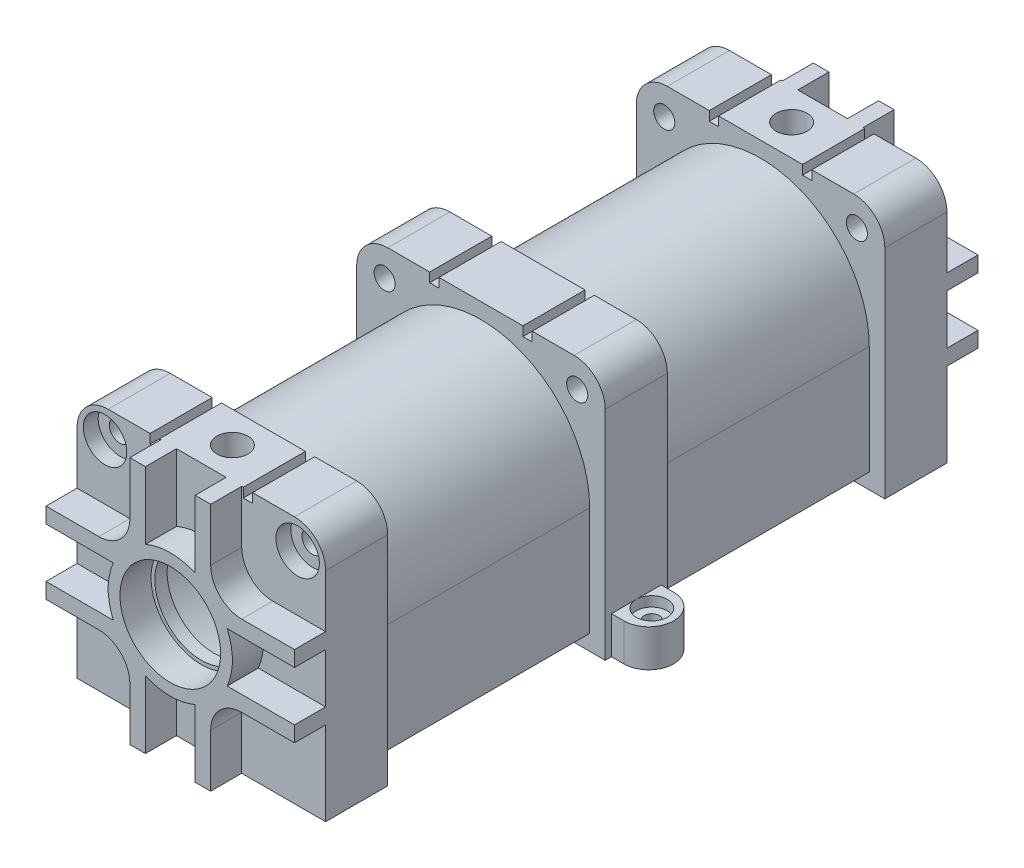
from build123d import *

# Parameters (mm, degrees)
ESBO_O1_W                                            = 40
ESBO_O1_H                                            = 100
RESSALTO_EXTRUS_O1_DEPTH                             = 20
CORTE_EXTRUS_O1_DEPTH                                = 58.445626465
CORTE_EXTRUS_O1_DEPTH_BACK                           = 40
ESBO_O2_R                                            = 16
CORTE_EXTRUS_O5_START                                = -5
ESBO_O9_W                                            = 40
ESBO_O9_H                                            = 40
CORTE_EXTRUS_O5_DEPTH                                = 35
CORTE_EXTRUS_O7_START                                = 40
ESBO_O9_4_W                                          = 40
ESBO_O9_4_H                                          = 40
CORTE_EXTRUS_O7_DEPTH                                = 35
RESSALTO_EXTRUS_O2_DEPTH                             = 6
REBAIXO_PARA_PARAFUSO_DE_M_QUINA_COM_CAB_D           = 2.4
REBAIXO_PARA_PARAFUSO_DE_M_QUINA_COM_CAB_CBORE_D     = 5
REBAIXO_PARA_PARAFUSO_DE_M_QUINA_COM_CAB_CBORE_DEPTH = 1.6
REBAIXO_PARA_PARAFUSO_DE_M_QUINA_COM_2_D             = 3.4
REBAIXO_PARA_PARAFUSO_DE_M_QUINA_COM_2_CBORE_D       = 7
REBAIXO_PARA_PARAFUSO_DE_M_QUINA_COM_2_CBORE_DEPTH   = 2.4
FILETE4_R                                            = 5
REBAIXO_PARA_PARAFUSO_DE_M_QUINA_COM_3_D             = 3.4
REBAIXO_PARA_PARAFUSO_DE_M_QUINA_COM_3_DEPTH         = 10.05
REBAIXO_PARA_PARAFUSO_DE_M_QUINA_COM_3_CBORE_D       = 7
REBAIXO_PARA_PARAFUSO_DE_M_QUINA_COM_3_CBORE_DEPTH   = 2.4
REBAIXO_PARA_PARAFUSO_DE_M_QUINA_COM_3_TIP           = 1.021463052
ESBO_O20_W                                           = 1.5
ESBO_O20_H                                           = 3
CORTE_EXTRUS_O8_DEPTH                                = 106.242576935
ESBO_O21_R                                           = 2.50059394
CORTE_EXTRUS_O9_DEPTH                                = 5
RESSALTO_EXTRUS_O3_DEPTH                             = 5
ESBO_O23_R                                           = 10
RESSALTO_EXTRUS_O4_DEPTH                             = 2
FILETE5_R                                            = 2
RESSALTO_EXTRUS_O5_START                             = -2
ESBO_O24_R                                           = 16
ESBO_O24_R_2                                         = 7.5
RESSALTO_EXTRUS_O5_DEPTH                             = 2
ESBO_O26_R                                           = 8.1
CORTE_EXTRUS_O10_DEPTH                               = 5


with BuildPart() as part:
    # Esboço1 → Ressalto-extrusão1 (new, symmetric)
    with BuildSketch(Plane(origin=(0, 0, 0), x_dir=(1, 0, 0), z_dir=(0, 1, 0))):
        Rectangle(ESBO_O1_W, ESBO_O1_H)
    extrude(amount=RESSALTO_EXTRUS_O1_DEPTH, both=True)

    # Esboço2 → Corte-extrusão1 (cut, two sides: drawn at the far end of the back side and taken through both)
    with BuildSketch(Plane.XY.offset(-CORTE_EXTRUS_O1_DEPTH_BACK)):
        Circle(ESBO_O2_R)
    extrude(amount=CORTE_EXTRUS_O1_DEPTH + CORTE_EXTRUS_O1_DEPTH_BACK, mode=Mode.SUBTRACT)

    # Esboço9 → Corte-extrusão5 (cut)
    with BuildSketch(Plane.XY.offset(CORTE_EXTRUS_O5_START)):
        Rectangle(ESBO_O9_W, ESBO_O9_H)
        with BuildLine():
            Line((17.5, -17.5), (-17.5, -17.5))
            Line((-17.5, -17.5), (-17.5, 0))
            ThreePointArc((-17.5, 0), (0, 17.5), (17.5, 0))
            Line((17.5, 0), (17.5, -17.5))
        make_face(mode=Mode.SUBTRACT)
    extrude(amount=-CORTE_EXTRUS_O5_DEPTH, mode=Mode.SUBTRACT)

    # Esboço9<4> → Corte-extrusão7 (cut)
    with BuildSketch(Plane.XY.offset(CORTE_EXTRUS_O7_START)):
        Rectangle(ESBO_O9_4_W, ESBO_O9_4_H)
        with BuildLine():
            Line((17.5, -17.5), (-17.5, -17.5))
            Line((-17.5, -17.5), (-17.5, 0))
            ThreePointArc((-17.5, 0), (0, 17.5), (17.5, 0))
            Line((17.5, 0), (17.5, -17.5))
        make_face(mode=Mode.SUBTRACT)
    extrude(amount=-CORTE_EXTRUS_O7_DEPTH, mode=Mode.SUBTRACT)

    # Esboço3 → Ressalto-extrusão2 (add)
    with BuildSketch(Plane.XZ.offset(20)):
        with BuildLine():
            Line((20, 4), (20, -4))
            Line((20, -4), (22, -4))
            ThreePointArc((22, -4), (26, 0), (22, 4))
            Line((22, 4), (20, 4))
        make_face()
        with BuildLine():
            Line((-20, -4), (-22, -4))
            ThreePointArc((-22, -4), (-26, 0), (-22, 4))
            Line((-22, 4), (-20, 4))
            Line((-20, 4), (-20, -4))
        make_face()
    extrude(amount=-RESSALTO_EXTRUS_O2_DEPTH)

    # Rebaixo para parafuso de m_quina com cab (through all)
    with Locations(Plane(origin=(0, -14, 0), x_dir=(1, 0, 0), z_dir=(0, 1, 0))):
        with Locations((22.5, 0), (-22.5, 0)):
            CounterBoreHole(REBAIXO_PARA_PARAFUSO_DE_M_QUINA_COM_CAB_D / 2, REBAIXO_PARA_PARAFUSO_DE_M_QUINA_COM_CAB_CBORE_D / 2, REBAIXO_PARA_PARAFUSO_DE_M_QUINA_COM_CAB_CBORE_DEPTH)

    # Rebaixo para parafuso de m_quina com 2 (through all)
    with Locations(Plane.XY.offset(50)):
        with Locations((-15.5, 15.5), (15.5, 15.5)):
            CounterBoreHole(REBAIXO_PARA_PARAFUSO_DE_M_QUINA_COM_2_D / 2, REBAIXO_PARA_PARAFUSO_DE_M_QUINA_COM_2_CBORE_D / 2, REBAIXO_PARA_PARAFUSO_DE_M_QUINA_COM_2_CBORE_DEPTH)

    # Filete4
    filete4_edges = [part.edges().sort_by_distance(p)[0] for p in [
        (20, 20, 45),
        (-20, 20, 0),
        (20, 20, -45),
        (-20, 20, 45),
        (20, 20, 0),
        (-20, 20, -45),
    ]]
    fillet(filete4_edges, radius=FILETE4_R)

    # Rebaixo para parafuso de m_quina com 3
    with Locations(Plane(origin=(0, 0, -50), x_dir=(-1, 0, 0), z_dir=(0, 0, -1))):
        with Locations((-15.5, 15.5), (15.5, 15.5)):
            CounterBoreHole(REBAIXO_PARA_PARAFUSO_DE_M_QUINA_COM_3_D / 2, REBAIXO_PARA_PARAFUSO_DE_M_QUINA_COM_3_CBORE_D / 2, REBAIXO_PARA_PARAFUSO_DE_M_QUINA_COM_3_CBORE_DEPTH, depth=REBAIXO_PARA_PARAFUSO_DE_M_QUINA_COM_3_DEPTH)
            with Locations((0, 0, -(REBAIXO_PARA_PARAFUSO_DE_M_QUINA_COM_3_DEPTH + REBAIXO_PARA_PARAFUSO_DE_M_QUINA_COM_3_TIP / 2))):  # 118° drill point
                Cone(0, REBAIXO_PARA_PARAFUSO_DE_M_QUINA_COM_3_D / 2, REBAIXO_PARA_PARAFUSO_DE_M_QUINA_COM_3_TIP, mode=Mode.SUBTRACT)

    # Esboço20 → Corte-extrusão8 (cut, through all)
    with BuildSketch(Plane(origin=(0, 0, -50), x_dir=(-1, 0, 0), z_dir=(0, 0, -1))):
        with Locations((7.5, 20)):
            Rectangle(ESBO_O20_W, ESBO_O20_H)
        with Locations((-7.5, 20)):
            Rectangle(ESBO_O20_W, ESBO_O20_H)
    extrude(amount=-CORTE_EXTRUS_O8_DEPTH, mode=Mode.SUBTRACT)

    # Esboço21 → Corte-extrusão9 (cut)
    with BuildSketch(Plane(origin=(0, 20, 0), x_dir=(1, 0, 0), z_dir=(0, 1, 0))):
        with Locations(Location((0, -45, 0), (0, 0, 270))):
            Circle(ESBO_O21_R)
        with Locations(Location((0, 45, 0), (0, 0, 270))):
            Circle(ESBO_O21_R)
    extrude(amount=-CORTE_EXTRUS_O9_DEPTH, mode=Mode.SUBTRACT)

    # Esboço22 → Ressalto-extrusão3 (add)
    with BuildSketch(Plane(origin=(0, 0, -50), x_dir=(-1, 0, 0), z_dir=(0, 0, -1))):
        with BuildLine():
            Line((-6.5, 20), (-6.5, 11.5))
            ThreePointArc((-6.5, 11.5), (-7.964466094, 7.964466094), (-11.5, 6.5))
            Line((-11.5, 6.5), (-20, 6.5))
            Line((-20, 6.5), (-20, 4))
            Line((-20, 4), (-9.16515139, 4))
            ThreePointArc((-9.16515139, 4), (-10, 0), (-9.16515139, -4))
            Line((-9.16515139, -4), (-20, -4))
            Line((-20, -4), (-20, -6.5))
            Line((-20, -6.5), (-11.5, -6.5))
            ThreePointArc((-11.5, -6.5), (-7.964466094, -7.964466094), (-6.5, -11.5))
            Line((-6.5, -11.5), (-6.5, -20))
            Line((-6.5, -20), (-4, -20))
            Line((-4, -20), (-4, -9.16515139))
            ThreePointArc((-4, -9.16515139), (0, -10), (4, -9.16515139))
            Line((4, -9.16515139), (4, -20))
            Line((4, -20), (6.5, -20))
            Line((6.5, -20), (6.5, -11.5))
            ThreePointArc((6.5, -11.5), (7.964466094, -7.964466094), (11.5, -6.5))
            Line((11.5, -6.5), (20, -6.5))
            Line((20, -6.5), (20, -4))
            Line((20, -4), (9.16515139, -4))
            ThreePointArc((9.16515139, -4), (10, 0), (9.16515139, 4))
            Line((9.16515139, 4), (20, 4))
            Line((20, 4), (20, 6.5))
            Line((20, 6.5), (11.5, 6.5))
            ThreePointArc((11.5, 6.5), (7.964466094, 7.964466094), (6.5, 11.5))
            Line((6.5, 11.5), (6.5, 20))
            Line((6.5, 20), (4, 20))
            Line((4, 20), (4, 9.16515139))
            ThreePointArc((4, 9.16515139), (0, 10), (-4, 9.16515139))
            Line((-4, 9.16515139), (-4, 20))
            Line((-4, 20), (-6.5, 20))
        make_face()
    ressalto_extrus_o3 = extrude(amount=RESSALTO_EXTRUS_O3_DEPTH)

    # Esboço23 → Ressalto-extrusão4 (add)
    with BuildSketch(Plane(origin=(0, 0, -55), x_dir=(-1, 0, 0), z_dir=(0, 0, -1))):
        with Locations(Location((0, 0, 0), (0, 0, 156.421821522))):
            Circle(ESBO_O23_R)
    extrude(amount=RESSALTO_EXTRUS_O4_DEPTH)

    # Filete5
    filete5_edges = [part.edges().sort_by_distance(p)[0] for p in [
        (-9.16515139, -4, -57),
    ]]
    fillet(filete5_edges, radius=FILETE5_R - 0.0001)  # a hair under: the kernel refuses the full size

    # Esboço24 → Ressalto-extrusão5 (add)
    with BuildSketch(Plane.XY.offset(50).offset(RESSALTO_EXTRUS_O5_START)):
        Circle(ESBO_O24_R)
        Circle(ESBO_O24_R_2, mode=Mode.SUBTRACT)
    extrude(amount=RESSALTO_EXTRUS_O5_DEPTH)

    # Espelhar1: Ressalto-extrusão3 across plane
    add(ressalto_extrus_o3.mirror(Plane.XY))

    # Esboço26 → Corte-extrusão10 (cut)
    with BuildSketch(Plane.XY.offset(55)):
        Circle(ESBO_O26_R)
    extrude(amount=-CORTE_EXTRUS_O10_DEPTH, mode=Mode.SUBTRACT)


solid = part.part
